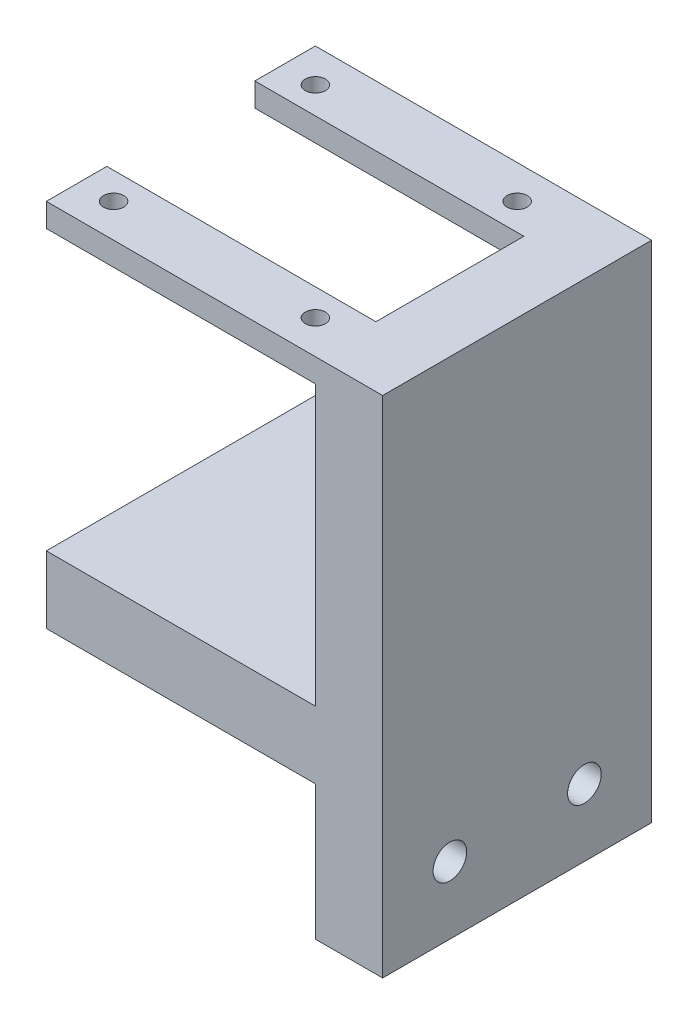
from build123d import *

# Parameters (mm, degrees)
SKETCH1_W           = 40
SKETCH1_H           = 75
SKETCH1_R           = 2.5
BOSS_EXTRUDE1_DEPTH = 10
SKETCH3_W           = 40
SKETCH3_H           = 10
BOSS_EXTRUDE2_DEPTH = 40
SKETCH4_W           = 9
SKETCH4_H           = 3.5
BOSS_EXTRUDE3_DEPTH = 40
CUT_EXTRUDE1_REACH  = 89.321
SKETCH5_R           = 1.5


with BuildPart() as part:
    # Sketch1 → Boss-Extrude1 (new body)
    with BuildSketch(Plane(origin=(0, 0, 0), x_dir=(0, 0, -1), z_dir=(1, 0, 0))):
        with Locations((0, 17.5)):
            Rectangle(SKETCH1_W, SKETCH1_H)
        with Locations((10, -10)):
            Circle(SKETCH1_R, mode=Mode.SUBTRACT)
        with Locations((-10, -10)):
            Circle(SKETCH1_R, mode=Mode.SUBTRACT)
    extrude(amount=BOSS_EXTRUDE1_DEPTH)

    # Sketch3 → Boss-Extrude2 (add)
    with BuildSketch(Plane.ZY):
        with Locations((0, 5)):
            Rectangle(SKETCH3_W, SKETCH3_H)
    extrude(amount=BOSS_EXTRUDE2_DEPTH)

    # Sketch4 → Boss-Extrude3 (add)
    with BuildSketch(Plane.ZY):
        with Locations((-15.5, 53.25)):
            Rectangle(SKETCH4_W, SKETCH4_H)
    boss_extrude3 = extrude(amount=BOSS_EXTRUDE3_DEPTH)

    # Sketch5 → Cut-Extrude1 (cut, up to next)
    with BuildSketch(Plane(origin=(0, 55, 0), x_dir=(1, 0, 0), z_dir=(0, 1, 0)), mode=Mode.PRIVATE) as cut_extrude1_sk1:
        with Locations((-35, 15)):
            Circle(SKETCH5_R)
    cut_extrude1_tool1 = extrude(cut_extrude1_sk1.sketch, amount=-CUT_EXTRUDE1_REACH, mode=Mode.PRIVATE) & part.part
    # Sketch5 → Cut-Extrude1 (cut, up to next)
    with BuildSketch(Plane(origin=(0, 55, 0), x_dir=(1, 0, 0), z_dir=(0, 1, 0)), mode=Mode.PRIVATE) as cut_extrude1_sk2:
        with Locations((-5, 15)):
            Circle(SKETCH5_R)
    cut_extrude1_tool2 = extrude(cut_extrude1_sk2.sketch, amount=-CUT_EXTRUDE1_REACH, mode=Mode.PRIVATE) & part.part
    cut_extrude1_1 = cut_extrude1_tool1.solids().sort_by_distance((-35, 55, -15))[0]
    add(cut_extrude1_1, mode=Mode.SUBTRACT)
    cut_extrude1_2 = cut_extrude1_tool2.solids().sort_by_distance((-5, 55, -15))[0]
    add(cut_extrude1_2, mode=Mode.SUBTRACT)
    cut_extrude1 = cut_extrude1_1 + cut_extrude1_2  # Cut-Extrude1 as one shape, for the pattern or mirror that repeats it

    # Mirror2: Boss-Extrude3, Cut-Extrude1 across plane
    add(boss_extrude3.mirror(Plane.XY))
    add(cut_extrude1.mirror(Plane.XY), mode=Mode.SUBTRACT)


solid = part.part
